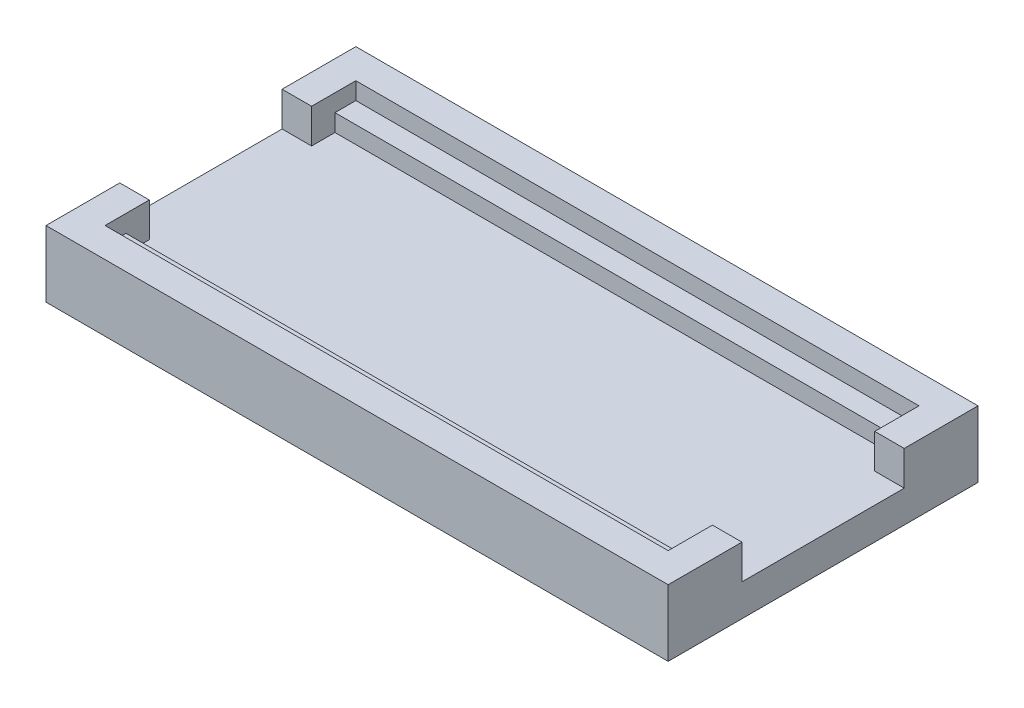
from build123d import *

# Parameters (mm, degrees)
SKETCH1_W           = 253
SKETCH1_H           = 126
BOSS_EXTRUDE1_DEPTH = 27
SKETCH2_W           = 229
SKETCH2_H           = 102
CUT_EXTRUDE1_DEPTH  = 7
SKETCH3_W           = 229
SKETCH3_H           = 85
CUT_EXTRUDE2_DEPTH  = 7
SKETCH4_W           = 12
SKETCH4_H           = 66
CUT_EXTRUDE3_DEPTH  = 14
SKETCH5_W           = 12
SKETCH5_H           = 66
CUT_EXTRUDE4_DEPTH  = 14


with BuildPart() as part:
    # Sketch1 → Boss-Extrude1 (new body)
    with BuildSketch(Plane(origin=(0, 0, 0), x_dir=(1, 0, 0), z_dir=(0, 1, 0))):
        with Locations((126.5, 63)):
            Rectangle(SKETCH1_W, SKETCH1_H)
    extrude(amount=BOSS_EXTRUDE1_DEPTH)

    # Sketch2 → Cut-Extrude1 (cut)
    with BuildSketch(Plane(origin=(0, 27, 0), x_dir=(1, 0, 0), z_dir=(0, 1, 0))):
        with Locations((126.5, 63)):
            Rectangle(SKETCH2_W, SKETCH2_H)
    extrude(amount=-CUT_EXTRUDE1_DEPTH, mode=Mode.SUBTRACT)

    # Sketch3 → Cut-Extrude2 (cut)
    with BuildSketch(Plane(origin=(0, 20, 0), x_dir=(1, 0, 0), z_dir=(0, 1, 0))):
        with Locations((126.5, 63)):
            Rectangle(SKETCH3_W, SKETCH3_H)
    extrude(amount=-CUT_EXTRUDE2_DEPTH, mode=Mode.SUBTRACT)

    # Sketch4 → Cut-Extrude3 (cut)
    with BuildSketch(Plane(origin=(0, 27, 0), x_dir=(1, 0, 0), z_dir=(0, 1, 0))):
        with Locations((6, 63)):
            Rectangle(SKETCH4_W, SKETCH4_H)
    extrude(amount=-CUT_EXTRUDE3_DEPTH, mode=Mode.SUBTRACT)

    # Sketch5 → Cut-Extrude4 (cut)
    with BuildSketch(Plane(origin=(0, 27, 0), x_dir=(1, 0, 0), z_dir=(0, 1, 0))):
        with Locations((247, 63)):
            Rectangle(SKETCH5_W, SKETCH5_H)
    extrude(amount=-CUT_EXTRUDE4_DEPTH, mode=Mode.SUBTRACT)


solid = part.part
